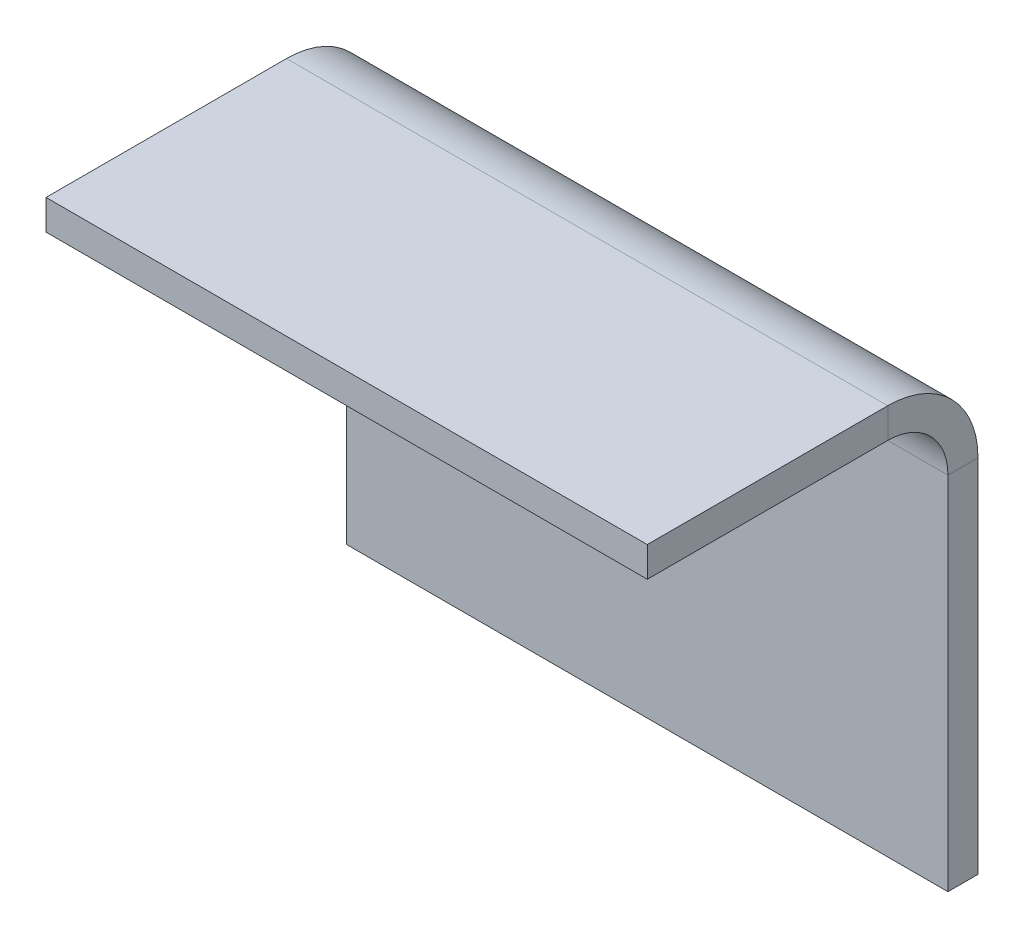
from build123d import *

# Parameters (mm, degrees)
SKETCH_1_W            = 20
SKETCH_1_H            = 10
BASEPLATE_DEPTH       = 1
EDGEFLANGE_DEPTH      = 20
EDGEFLANGE_FLAT_DEPTH = 1


# Sheet-metal steps are written as plain solids
with BuildPart() as part:
    # BasePlate: sheet metal written as solids
    # Sketch 1 → BasePlate (new body)
    with BuildSketch(Plane.XY):
        with Locations((10, 5)):
            Rectangle(SKETCH_1_W, SKETCH_1_H)
    extrude(amount=-BASEPLATE_DEPTH)

    # EdgeFlange: sheet metal written as solids
    # EdgeFlange bend section (on a plane across the edge) → EdgeFlange (add)
    with BuildSketch(Plane(origin=(20, 15, 0), x_dir=(0, -1, 0), z_dir=(-1, 0, 0))):
        with BuildLine():
            Line((0, 2), (1, 2))
            ThreePointArc((1, 2), (1.585786438, 0.585786438), (3, 0))
            Line((3, 0), (5, 0))
            Line((5, 0), (5, -1))
            Line((5, -1), (3, -1))
            ThreePointArc((3, -1), (0.878679656, -0.121320344), (0, 2))
        make_face()
    extrude(amount=EDGEFLANGE_DEPTH)

    # EdgeFlange profile (on flange) → EdgeFlange flat (add)
    with BuildSketch(Plane(origin=(0, 15, 0), x_dir=(-1, 0, 0), z_dir=(0, 1, 0))):
        Polygon((-20, 10), (-20, 2), (0, 2), (0, 10), (-2, 10), (-18, 10), align=None)
    extrude(amount=-EDGEFLANGE_FLAT_DEPTH)


solid = part.part
